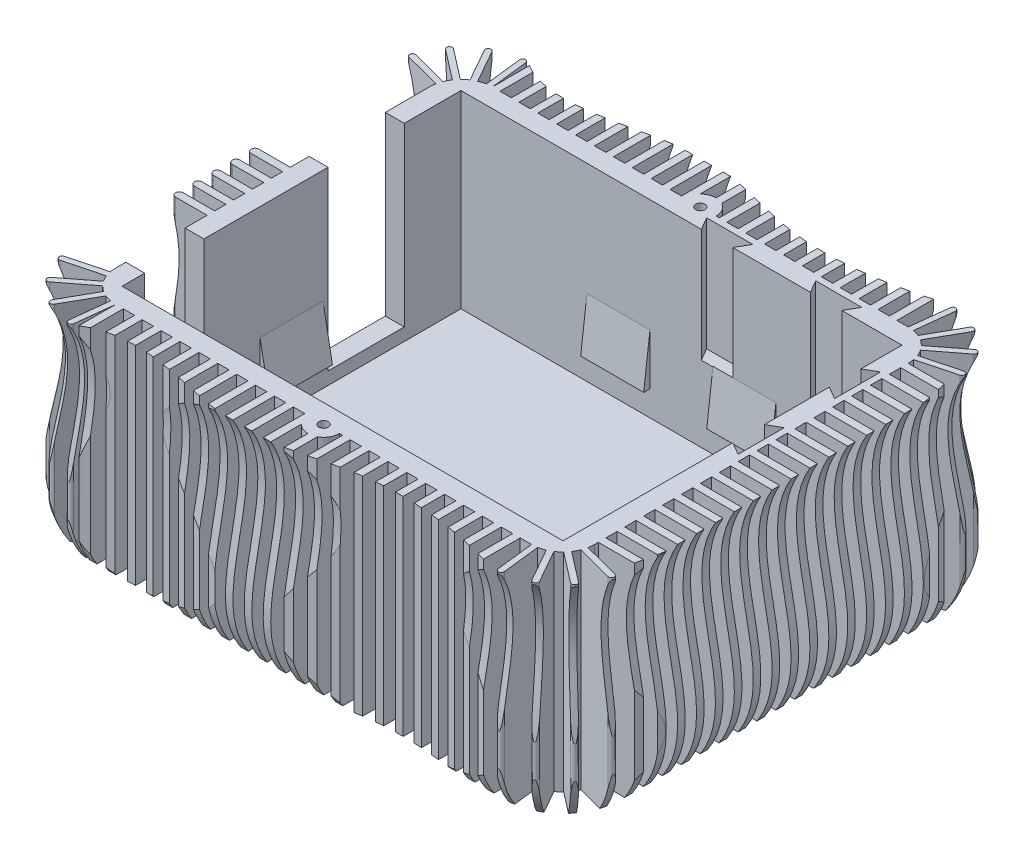
from build123d import *

# Parameters (mm, degrees)
CROQUIS1_W               = 76
CROQUIS1_H               = 59.8
CROQUIS1_W_2             = 70
CROQUIS1_H_2             = 53.8
SALIENTE_EXTRUIR1_DEPTH  = 15
CROQUIS3_W               = 76
CROQUIS3_H               = 59.8
SALIENTE_EXTRUIR2_DEPTH  = 3
CROQUIS4_W               = 6
CROQUIS4_H               = 12.1
CROQUIS4_H_2             = 9.4
CORTAR_EXTRUIR1_DEPTH    = 28
SALIENTE_EXTRUIR3_DEPTH  = 5
SALIENTE_EXTRUIR4_DEPTH  = 5
MATRIZL1_COUNT           = 2
MATRIZL1_PITCH           = 20
MATRIZL2_COUNT           = 2
MATRIZL2_PITCH           = 20
MATRIZL2_COL_COUNT       = 2
MATRIZL2_COL_PITCH       = 20
REDONDEO1_R              = 5
SALIENTE_EXTRUIR6_START  = -18
SALIENTE_EXTRUIR6_DEPTH  = 33
MATRIZL3_COUNT           = 22
MATRIZL3_PITCH           = 3
SIMETR_A1_START          = -18
SIMETR_A1_COPY_1_DEPTH   = 33
SIMETR_A1_COPY_2_DEPTH   = 33
SIMETR_A1_COPY_3_DEPTH   = 33
SIMETR_A1_COPY_4_DEPTH   = 33
SIMETR_A1_COPY_5_DEPTH   = 33
SIMETR_A1_COPY_6_DEPTH   = 33
SIMETR_A1_COPY_7_DEPTH   = 33
SIMETR_A1_COPY_8_DEPTH   = 33
SIMETR_A1_COPY_9_DEPTH   = 33
SIMETR_A1_COPY_10_DEPTH  = 33
SIMETR_A1_COPY_11_DEPTH  = 33
SIMETR_A1_COPY_12_DEPTH  = 33
SIMETR_A1_COPY_13_DEPTH  = 33
SIMETR_A1_COPY_14_DEPTH  = 33
SIMETR_A1_COPY_15_DEPTH  = 33
SIMETR_A1_COPY_16_DEPTH  = 33
SIMETR_A1_COPY_17_DEPTH  = 33
SIMETR_A1_COPY_18_DEPTH  = 33
SIMETR_A1_COPY_19_DEPTH  = 33
SIMETR_A1_COPY_20_DEPTH  = 33
SIMETR_A1_COPY_21_DEPTH  = 33
SALIENTE_EXTRUIR7_DEPTH  = 33
MATRIZ_CRV3_COUNT        = 4
MATRIZ_CRV3_ANGLE        = 68.754935416
SIMETR_A2_COPY_1_DEPTH   = 33
SIMETR_A2_COPY_2_DEPTH   = 33
SIMETR_A2_COPY_3_DEPTH   = 33
SALIENTE_EXTRUIR9_START  = -18
SALIENTE_EXTRUIR9_DEPTH  = 33
MATRIZL4_COUNT           = 17
MATRIZL4_PITCH           = 3
SIMETR_A3_COPY_1_DEPTH   = 33
SIMETR_A3_COPY_2_DEPTH   = 33
SIMETR_A3_COPY_3_DEPTH   = 33
SIMETR_A3_COPY_4_DEPTH   = 33
SIMETR_A3_COPY_5_DEPTH   = 33
SIMETR_A3_COPY_6_DEPTH   = 33
SIMETR_A3_COPY_7_DEPTH   = 33
SALIENTE_EXTRUIR10_START = -18
SALIENTE_EXTRUIR10_DEPTH = 33
SALIENTE_EXTRUIR11_DEPTH = 5
CORTAR_EXTRUIR2_DEPTH    = 18
CORTAR_EXTRUIR3_DEPTH    = 26.5
CORTAR_EXTRUIR4_DEPTH    = 26.5
SALIENTE_EXTRUIR12_START = -18
SALIENTE_EXTRUIR12_DEPTH = 33
CROQUIS19_R              = 0.75
CORTAR_EXTRUIR5_DEPTH    = 53


# Read off the part's stored shape, not the designer's step: Saliente-Extruir12
with BuildPart() as part:
    # Croquis1 → Saliente-Extruir1 (new, symmetric)
    with BuildSketch(Plane(origin=(0, 0, 0), x_dir=(1, 0, 0), z_dir=(0, 1, 0))):
        Rectangle(CROQUIS1_W, CROQUIS1_H)
        Rectangle(CROQUIS1_W_2, CROQUIS1_H_2, mode=Mode.SUBTRACT)
    extrude(amount=SALIENTE_EXTRUIR1_DEPTH, both=True)

    # Croquis3 → Saliente-Extruir2 (add)
    with BuildSketch(Plane.XZ.offset(15)):
        Rectangle(CROQUIS3_W, CROQUIS3_H)
    extrude(amount=SALIENTE_EXTRUIR2_DEPTH)

    # Croquis4 → Cortar-Extruir1 (cut)
    with BuildSketch(Plane(origin=(0, 15, 0), x_dir=(1, 0, 0), z_dir=(0, 1, 0))):
        with Locations((-38, 11.85)):
            Rectangle(CROQUIS4_W, CROQUIS4_H)
        with Locations((-38, -18.6)):
            Rectangle(CROQUIS4_W, CROQUIS4_H_2)
    extrude(amount=-CORTAR_EXTRUIR1_DEPTH, mode=Mode.SUBTRACT)

    # Croquis5 → Saliente-Extruir3 (add, symmetric)
    with BuildSketch(Plane(origin=(0, 0, 0), x_dir=(0, 0, -1), z_dir=(1, 0, 0))):
        Polygon((-26.9, -2.397546426), (-25.905143796, -10.5), (-26.9, -10.5), align=None)
    saliente_extruir3 = extrude(amount=SALIENTE_EXTRUIR3_DEPTH, both=True)

    # Croquis6 → Saliente-Extruir4 (add, symmetric)
    with BuildSketch(Plane(origin=(10, 0, -10), x_dir=(0, 0, 1), z_dir=(-1, 0, 0))):
        Polygon((-16.9, -2.897546426), (-15.905143796, -11), (-16.9, -11), align=None)
    saliente_extruir4 = extrude(amount=SALIENTE_EXTRUIR4_DEPTH, both=True)

    # MatrizL1: Saliente-Extruir4 ×2
    with Locations(*[(-i * MATRIZL1_PITCH, 0, 0) for i in range(1, MATRIZL1_COUNT)]):
        add(saliente_extruir4)

    # MatrizL2: Saliente-Extruir3 ×2
    with Locations(*[(i * MATRIZL2_PITCH, 0, 0) for i in range(1, MATRIZL2_COUNT)]):
        add(saliente_extruir3)

    # MatrizL2 col: Saliente-Extruir3 ×2
    with Locations(*[(-i * MATRIZL2_COL_PITCH, 0, 0) for i in range(1, MATRIZL2_COL_COUNT)]):
        add(saliente_extruir3)

    # Redondeo1
    redondeo1_edges = [part.edges().sort_by_distance(p)[0] for p in [
        (-38, -1.5, 29.9),
        (-38, -1.5, -29.9),
        (38, -1.5, -29.9),
        (38, -1.5, 29.9),
    ]]
    fillet(redondeo1_edges, radius=REDONDEO1_R)

    # Croquis7 → Saliente-Extruir6 (add)
    with BuildSketch(Plane(origin=(0, 0, 0), x_dir=(1, 0, 0), z_dir=(0, 1, 0)).offset(SALIENTE_EXTRUIR6_START)):
        with BuildLine():
            Line((-33, 29.9), (-31.8, 29.9))
            Line((-31.8, 29.9), (-31.8, 37.9))
            ThreePointArc((-31.8, 37.9), (-32.4, 38.5), (-33, 37.9))
            Line((-33, 37.9), (-33, 29.9))
        make_face()
    saliente_extruir6 = extrude(amount=SALIENTE_EXTRUIR6_DEPTH)

    # MatrizL3: Saliente-Extruir6 ×22
    with Locations(*[(i * MATRIZL3_PITCH, 0, 0) for i in range(1, MATRIZL3_COUNT)]):
        add(saliente_extruir6)

    # Simetría1: Saliente-Extruir6 across plane
    add(saliente_extruir6.mirror(Plane.XY))

    # Simetría1 copy 1 sketch → Simetría1 copy 1 (add)
    with BuildSketch(Plane(origin=(3, 0, 0), x_dir=(1, 0, 0), z_dir=(0, 1, 0)).offset(SIMETR_A1_START)):
        with BuildLine():
            Line((-33, -29.9), (-31.8, -29.9))
            Line((-31.8, -29.9), (-31.8, -37.9))
            ThreePointArc((-31.8, -37.9), (-32.4, -38.5), (-33, -37.9))
            Line((-33, -37.9), (-33, -29.9))
        make_face()
    extrude(amount=SIMETR_A1_COPY_1_DEPTH)

    # Simetría1 copy 2 sketch → Simetría1 copy 2 (add)
    with BuildSketch(Plane(origin=(6, 0, 0), x_dir=(1, 0, 0), z_dir=(0, 1, 0)).offset(SIMETR_A1_START)):
        with BuildLine():
            Line((-33, -29.9), (-31.8, -29.9))
            Line((-31.8, -29.9), (-31.8, -37.9))
            ThreePointArc((-31.8, -37.9), (-32.4, -38.5), (-33, -37.9))
            Line((-33, -37.9), (-33, -29.9))
        make_face()
    extrude(amount=SIMETR_A1_COPY_2_DEPTH)

    # Simetría1 copy 3 sketch → Simetría1 copy 3 (add)
    with BuildSketch(Plane(origin=(9, 0, 0), x_dir=(1, 0, 0), z_dir=(0, 1, 0)).offset(SIMETR_A1_START)):
        with BuildLine():
            Line((-33, -29.9), (-31.8, -29.9))
            Line((-31.8, -29.9), (-31.8, -37.9))
            ThreePointArc((-31.8, -37.9), (-32.4, -38.5), (-33, -37.9))
            Line((-33, -37.9), (-33, -29.9))
        make_face()
    extrude(amount=SIMETR_A1_COPY_3_DEPTH)

    # Simetría1 copy 4 sketch → Simetría1 copy 4 (add)
    with BuildSketch(Plane(origin=(12, 0, 0), x_dir=(1, 0, 0), z_dir=(0, 1, 0)).offset(SIMETR_A1_START)):
        with BuildLine():
            Line((-33, -29.9), (-31.8, -29.9))
            Line((-31.8, -29.9), (-31.8, -37.9))
            ThreePointArc((-31.8, -37.9), (-32.4, -38.5), (-33, -37.9))
            Line((-33, -37.9), (-33, -29.9))
        make_face()
    extrude(amount=SIMETR_A1_COPY_4_DEPTH)

    # Simetría1 copy 5 sketch → Simetría1 copy 5 (add)
    with BuildSketch(Plane(origin=(15, 0, 0), x_dir=(1, 0, 0), z_dir=(0, 1, 0)).offset(SIMETR_A1_START)):
        with BuildLine():
            Line((-33, -29.9), (-31.8, -29.9))
            Line((-31.8, -29.9), (-31.8, -37.9))
            ThreePointArc((-31.8, -37.9), (-32.4, -38.5), (-33, -37.9))
            Line((-33, -37.9), (-33, -29.9))
        make_face()
    extrude(amount=SIMETR_A1_COPY_5_DEPTH)

    # Simetría1 copy 6 sketch → Simetría1 copy 6 (add)
    with BuildSketch(Plane(origin=(18, 0, 0), x_dir=(1, 0, 0), z_dir=(0, 1, 0)).offset(SIMETR_A1_START)):
        with BuildLine():
            Line((-33, -29.9), (-31.8, -29.9))
            Line((-31.8, -29.9), (-31.8, -37.9))
            ThreePointArc((-31.8, -37.9), (-32.4, -38.5), (-33, -37.9))
            Line((-33, -37.9), (-33, -29.9))
        make_face()
    extrude(amount=SIMETR_A1_COPY_6_DEPTH)

    # Simetría1 copy 7 sketch → Simetría1 copy 7 (add)
    with BuildSketch(Plane(origin=(21, 0, 0), x_dir=(1, 0, 0), z_dir=(0, 1, 0)).offset(SIMETR_A1_START)):
        with BuildLine():
            Line((-33, -29.9), (-31.8, -29.9))
            Line((-31.8, -29.9), (-31.8, -37.9))
            ThreePointArc((-31.8, -37.9), (-32.4, -38.5), (-33, -37.9))
            Line((-33, -37.9), (-33, -29.9))
        make_face()
    extrude(amount=SIMETR_A1_COPY_7_DEPTH)

    # Simetría1 copy 8 sketch → Simetría1 copy 8 (add)
    with BuildSketch(Plane(origin=(24, 0, 0), x_dir=(1, 0, 0), z_dir=(0, 1, 0)).offset(SIMETR_A1_START)):
        with BuildLine():
            Line((-33, -29.9), (-31.8, -29.9))
            Line((-31.8, -29.9), (-31.8, -37.9))
            ThreePointArc((-31.8, -37.9), (-32.4, -38.5), (-33, -37.9))
            Line((-33, -37.9), (-33, -29.9))
        make_face()
    extrude(amount=SIMETR_A1_COPY_8_DEPTH)

    # Simetría1 copy 9 sketch → Simetría1 copy 9 (add)
    with BuildSketch(Plane(origin=(27, 0, 0), x_dir=(1, 0, 0), z_dir=(0, 1, 0)).offset(SIMETR_A1_START)):
        with BuildLine():
            Line((-33, -29.9), (-31.8, -29.9))
            Line((-31.8, -29.9), (-31.8, -37.9))
            ThreePointArc((-31.8, -37.9), (-32.4, -38.5), (-33, -37.9))
            Line((-33, -37.9), (-33, -29.9))
        make_face()
    extrude(amount=SIMETR_A1_COPY_9_DEPTH)

    # Simetría1 copy 10 sketch → Simetría1 copy 10 (add)
    with BuildSketch(Plane(origin=(30, 0, 0), x_dir=(1, 0, 0), z_dir=(0, 1, 0)).offset(SIMETR_A1_START)):
        with BuildLine():
            Line((-33, -29.9), (-31.8, -29.9))
            Line((-31.8, -29.9), (-31.8, -37.9))
            ThreePointArc((-31.8, -37.9), (-32.4, -38.5), (-33, -37.9))
            Line((-33, -37.9), (-33, -29.9))
        make_face()
    extrude(amount=SIMETR_A1_COPY_10_DEPTH)

    # Simetría1 copy 11 sketch → Simetría1 copy 11 (add)
    with BuildSketch(Plane(origin=(33, 0, 0), x_dir=(1, 0, 0), z_dir=(0, 1, 0)).offset(SIMETR_A1_START)):
        with BuildLine():
            Line((-33, -29.9), (-31.8, -29.9))
            Line((-31.8, -29.9), (-31.8, -37.9))
            ThreePointArc((-31.8, -37.9), (-32.4, -38.5), (-33, -37.9))
            Line((-33, -37.9), (-33, -29.9))
        make_face()
    extrude(amount=SIMETR_A1_COPY_11_DEPTH)

    # Simetría1 copy 12 sketch → Simetría1 copy 12 (add)
    with BuildSketch(Plane(origin=(36, 0, 0), x_dir=(1, 0, 0), z_dir=(0, 1, 0)).offset(SIMETR_A1_START)):
        with BuildLine():
            Line((-33, -29.9), (-31.8, -29.9))
            Line((-31.8, -29.9), (-31.8, -37.9))
            ThreePointArc((-31.8, -37.9), (-32.4, -38.5), (-33, -37.9))
            Line((-33, -37.9), (-33, -29.9))
        make_face()
    extrude(amount=SIMETR_A1_COPY_12_DEPTH)

    # Simetría1 copy 13 sketch → Simetría1 copy 13 (add)
    with BuildSketch(Plane(origin=(39, 0, 0), x_dir=(1, 0, 0), z_dir=(0, 1, 0)).offset(SIMETR_A1_START)):
        with BuildLine():
            Line((-33, -29.9), (-31.8, -29.9))
            Line((-31.8, -29.9), (-31.8, -37.9))
            ThreePointArc((-31.8, -37.9), (-32.4, -38.5), (-33, -37.9))
            Line((-33, -37.9), (-33, -29.9))
        make_face()
    extrude(amount=SIMETR_A1_COPY_13_DEPTH)

    # Simetría1 copy 14 sketch → Simetría1 copy 14 (add)
    with BuildSketch(Plane(origin=(42, 0, 0), x_dir=(1, 0, 0), z_dir=(0, 1, 0)).offset(SIMETR_A1_START)):
        with BuildLine():
            Line((-33, -29.9), (-31.8, -29.9))
            Line((-31.8, -29.9), (-31.8, -37.9))
            ThreePointArc((-31.8, -37.9), (-32.4, -38.5), (-33, -37.9))
            Line((-33, -37.9), (-33, -29.9))
        make_face()
    extrude(amount=SIMETR_A1_COPY_14_DEPTH)

    # Simetría1 copy 15 sketch → Simetría1 copy 15 (add)
    with BuildSketch(Plane(origin=(45, 0, 0), x_dir=(1, 0, 0), z_dir=(0, 1, 0)).offset(SIMETR_A1_START)):
        with BuildLine():
            Line((-33, -29.9), (-31.8, -29.9))
            Line((-31.8, -29.9), (-31.8, -37.9))
            ThreePointArc((-31.8, -37.9), (-32.4, -38.5), (-33, -37.9))
            Line((-33, -37.9), (-33, -29.9))
        make_face()
    extrude(amount=SIMETR_A1_COPY_15_DEPTH)

    # Simetría1 copy 16 sketch → Simetría1 copy 16 (add)
    with BuildSketch(Plane(origin=(48, 0, 0), x_dir=(1, 0, 0), z_dir=(0, 1, 0)).offset(SIMETR_A1_START)):
        with BuildLine():
            Line((-33, -29.9), (-31.8, -29.9))
            Line((-31.8, -29.9), (-31.8, -37.9))
            ThreePointArc((-31.8, -37.9), (-32.4, -38.5), (-33, -37.9))
            Line((-33, -37.9), (-33, -29.9))
        make_face()
    extrude(amount=SIMETR_A1_COPY_16_DEPTH)

    # Simetría1 copy 17 sketch → Simetría1 copy 17 (add)
    with BuildSketch(Plane(origin=(51, 0, 0), x_dir=(1, 0, 0), z_dir=(0, 1, 0)).offset(SIMETR_A1_START)):
        with BuildLine():
            Line((-33, -29.9), (-31.8, -29.9))
            Line((-31.8, -29.9), (-31.8, -37.9))
            ThreePointArc((-31.8, -37.9), (-32.4, -38.5), (-33, -37.9))
            Line((-33, -37.9), (-33, -29.9))
        make_face()
    extrude(amount=SIMETR_A1_COPY_17_DEPTH)

    # Simetría1 copy 18 sketch → Simetría1 copy 18 (add)
    with BuildSketch(Plane(origin=(54, 0, 0), x_dir=(1, 0, 0), z_dir=(0, 1, 0)).offset(SIMETR_A1_START)):
        with BuildLine():
            Line((-33, -29.9), (-31.8, -29.9))
            Line((-31.8, -29.9), (-31.8, -37.9))
            ThreePointArc((-31.8, -37.9), (-32.4, -38.5), (-33, -37.9))
            Line((-33, -37.9), (-33, -29.9))
        make_face()
    extrude(amount=SIMETR_A1_COPY_18_DEPTH)

    # Simetría1 copy 19 sketch → Simetría1 copy 19 (add)
    with BuildSketch(Plane(origin=(57, 0, 0), x_dir=(1, 0, 0), z_dir=(0, 1, 0)).offset(SIMETR_A1_START)):
        with BuildLine():
            Line((-33, -29.9), (-31.8, -29.9))
            Line((-31.8, -29.9), (-31.8, -37.9))
            ThreePointArc((-31.8, -37.9), (-32.4, -38.5), (-33, -37.9))
            Line((-33, -37.9), (-33, -29.9))
        make_face()
    extrude(amount=SIMETR_A1_COPY_19_DEPTH)

    # Simetría1 copy 20 sketch → Simetría1 copy 20 (add)
    with BuildSketch(Plane(origin=(60, 0, 0), x_dir=(1, 0, 0), z_dir=(0, 1, 0)).offset(SIMETR_A1_START)):
        with BuildLine():
            Line((-33, -29.9), (-31.8, -29.9))
            Line((-31.8, -29.9), (-31.8, -37.9))
            ThreePointArc((-31.8, -37.9), (-32.4, -38.5), (-33, -37.9))
            Line((-33, -37.9), (-33, -29.9))
        make_face()
    extrude(amount=SIMETR_A1_COPY_20_DEPTH)

    # Simetría1 copy 21 sketch → Simetría1 copy 21 (add)
    with BuildSketch(Plane(origin=(63, 0, 0), x_dir=(1, 0, 0), z_dir=(0, 1, 0)).offset(SIMETR_A1_START)):
        with BuildLine():
            Line((-33, -29.9), (-31.8, -29.9))
            Line((-31.8, -29.9), (-31.8, -37.9))
            ThreePointArc((-31.8, -37.9), (-32.4, -38.5), (-33, -37.9))
            Line((-33, -37.9), (-33, -29.9))
        make_face()
    extrude(amount=SIMETR_A1_COPY_21_DEPTH)

    # Croquis9 → Saliente-Extruir7 (add, through all)
    with BuildSketch(Plane(origin=(0, 15, 0), x_dir=(1, 0, 0), z_dir=(0, 1, 0))):
        with BuildLine():
            Line((33.685639557, 35.882409122), (33, 29.9))
            ThreePointArc((33, 29.9), (33.450129237, 29.879697146), (33.896602911, 29.818953468))
            Line((33.896602911, 29.818953468), (34.57978628, 35.779931616))
            Line((34.57978628, 35.779931616), (33.685639557, 35.882409122))
        make_face()
        with BuildLine():
            ThreePointArc((33.685639557, 35.882409122), (34.183951671, 36.27824373), (34.57978628, 35.779931616))
            Line((34.57978628, 35.779931616), (33.685639557, 35.882409122))
        make_face()
    saliente_extruir7 = extrude(amount=-SALIENTE_EXTRUIR7_DEPTH)

    # Matriz Crv3: Saliente-Extruir7 ×4 about axis
    matriz_crv3_axis = Axis((33, 15, -24.9), (0, -1, 0))
    for i in range(1, MATRIZ_CRV3_COUNT):
        add(saliente_extruir7.rotate(matriz_crv3_axis, i * MATRIZ_CRV3_ANGLE / (MATRIZ_CRV3_COUNT - 1)))

    # Simetría2: Saliente-Extruir7 across plane
    add(saliente_extruir7.mirror(Plane.XY))

    # Simetría2 copy 1 sketch → Simetría2 copy 1 (add, through all)
    with BuildSketch(Plane(origin=(-7.091529526, 15, 14.816386546), x_dir=(0.9210609940028849, 0, -0.3894183423086511), z_dir=(0, 1, 0))):
        with BuildLine():
            Line((33.685639557, -35.882409122), (33, -29.9))
            ThreePointArc((33, -29.9), (33.450129237, -29.879697146), (33.896602911, -29.818953468))
            Line((33.896602911, -29.818953468), (34.57978628, -35.779931616))
            Line((34.57978628, -35.779931616), (33.685639557, -35.882409122))
        make_face()
        with BuildLine():
            ThreePointArc((33.685639557, -35.882409122), (34.183951671, -36.27824373), (34.57978628, -35.779931616))
            Line((34.57978628, -35.779931616), (33.685639557, -35.882409122))
        make_face()
    extrude(amount=-SIMETR_A2_COPY_1_DEPTH)

    # Simetría2 copy 2 sketch → Simetría2 copy 2 (add, through all)
    with BuildSketch(Plane(origin=(-7.853488072, 15, 31.224753937), x_dir=(0.6967067093471645, 0, -0.7173560908995237), z_dir=(0, 1, 0))):
        with BuildLine():
            Line((33.685639557, -35.882409122), (33, -29.9))
            ThreePointArc((33, -29.9), (33.450129237, -29.879697146), (33.896602911, -29.818953468))
            Line((33.896602911, -29.818953468), (34.57978628, -35.779931616))
            Line((34.57978628, -35.779931616), (33.685639557, -35.882409122))
        make_face()
        with BuildLine():
            ThreePointArc((33.685639557, -35.882409122), (34.183951671, -36.27824373), (34.57978628, -35.779931616))
            Line((34.57978628, -35.779931616), (33.685639557, -35.882409122))
        make_face()
    extrude(amount=-SIMETR_A2_COPY_2_DEPTH)

    # Simetría2 copy 3 sketch → Simetría2 copy 3 (add, through all)
    with BuildSketch(Plane(origin=(-2.165579138, 15, 46.63458175), x_dir=(0.36235775447667173, 0, -0.9320390859672271), z_dir=(0, 1, 0))):
        with BuildLine():
            Line((33.685639557, -35.882409122), (33, -29.9))
            ThreePointArc((33, -29.9), (33.450129237, -29.879697146), (33.896602911, -29.818953468))
            Line((33.896602911, -29.818953468), (34.57978628, -35.779931616))
            Line((34.57978628, -35.779931616), (33.685639557, -35.882409122))
        make_face()
        with BuildLine():
            ThreePointArc((33.685639557, -35.882409122), (34.183951671, -36.27824373), (34.57978628, -35.779931616))
            Line((34.57978628, -35.779931616), (33.685639557, -35.882409122))
        make_face()
    extrude(amount=-SIMETR_A2_COPY_3_DEPTH)

    # Croquis11 → Saliente-Extruir9 (add)
    with BuildSketch(Plane(origin=(0, 0, 0), x_dir=(1, 0, 0), z_dir=(0, 1, 0)).offset(SALIENTE_EXTRUIR9_START)):
        with BuildLine():
            Line((38, 24.9), (46, 24.9))
            ThreePointArc((46, 24.9), (46.6, 24.3), (46, 23.7))
            Line((46, 23.7), (38, 23.7))
            Line((38, 23.7), (38, 24.9))
        make_face()
    saliente_extruir9 = extrude(amount=SALIENTE_EXTRUIR9_DEPTH)

    # MatrizL4: Saliente-Extruir9 ×17
    with Locations(*[(0, 0, i * MATRIZL4_PITCH) for i in range(1, MATRIZL4_COUNT)]):
        add(saliente_extruir9)

    # Simetría3: Saliente-Extruir7 across plane
    add(saliente_extruir7.mirror(Plane(origin=(0, 0, 0), x_dir=(0, 0, 1), z_dir=(1, 0, 0))))

    # Simetría3 copy 1 sketch → Simetría3 copy 1 (add, through all)
    with BuildSketch(Plane(origin=(7.091529526, 15, -14.816386546), x_dir=(-0.9210609940028849, 0, 0.3894183423086511), z_dir=(0, 1, 0))):
        with BuildLine():
            Line((33.685639557, -35.882409122), (33, -29.9))
            ThreePointArc((33, -29.9), (33.450129237, -29.879697146), (33.896602911, -29.818953468))
            Line((33.896602911, -29.818953468), (34.57978628, -35.779931616))
            Line((34.57978628, -35.779931616), (33.685639557, -35.882409122))
        make_face()
        with BuildLine():
            ThreePointArc((33.685639557, -35.882409122), (34.183951671, -36.27824373), (34.57978628, -35.779931616))
            Line((34.57978628, -35.779931616), (33.685639557, -35.882409122))
        make_face()
    extrude(amount=-SIMETR_A3_COPY_1_DEPTH)

    # Simetría3 copy 2 sketch → Simetría3 copy 2 (add, through all)
    with BuildSketch(Plane(origin=(7.853488072, 15, -31.224753937), x_dir=(-0.6967067093471645, 0, 0.7173560908995237), z_dir=(0, 1, 0))):
        with BuildLine():
            Line((33.685639557, -35.882409122), (33, -29.9))
            ThreePointArc((33, -29.9), (33.450129237, -29.879697146), (33.896602911, -29.818953468))
            Line((33.896602911, -29.818953468), (34.57978628, -35.779931616))
            Line((34.57978628, -35.779931616), (33.685639557, -35.882409122))
        make_face()
        with BuildLine():
            ThreePointArc((33.685639557, -35.882409122), (34.183951671, -36.27824373), (34.57978628, -35.779931616))
            Line((34.57978628, -35.779931616), (33.685639557, -35.882409122))
        make_face()
    extrude(amount=-SIMETR_A3_COPY_2_DEPTH)

    # Simetría3 copy 3 sketch → Simetría3 copy 3 (add, through all)
    with BuildSketch(Plane(origin=(2.165579138, 15, -46.63458175), x_dir=(-0.36235775447667173, 0, 0.9320390859672271), z_dir=(0, 1, 0))):
        with BuildLine():
            Line((33.685639557, -35.882409122), (33, -29.9))
            ThreePointArc((33, -29.9), (33.450129237, -29.879697146), (33.896602911, -29.818953468))
            Line((33.896602911, -29.818953468), (34.57978628, -35.779931616))
            Line((34.57978628, -35.779931616), (33.685639557, -35.882409122))
        make_face()
        with BuildLine():
            ThreePointArc((33.685639557, -35.882409122), (34.183951671, -36.27824373), (34.57978628, -35.779931616))
            Line((34.57978628, -35.779931616), (33.685639557, -35.882409122))
        make_face()
    extrude(amount=-SIMETR_A3_COPY_3_DEPTH)

    # Simetría3 copy 4 sketch → Simetría3 copy 4 (add, through all)
    with BuildSketch(Plane(origin=(0, 15, 0), x_dir=(-1, 0, 0), z_dir=(0, 1, 0))):
        with BuildLine():
            Line((33.685639557, 35.882409122), (33, 29.9))
            ThreePointArc((33, 29.9), (33.450129237, 29.879697146), (33.896602911, 29.818953468))
            Line((33.896602911, 29.818953468), (34.57978628, 35.779931616))
            Line((34.57978628, 35.779931616), (33.685639557, 35.882409122))
        make_face()
        with BuildLine():
            ThreePointArc((33.685639557, 35.882409122), (34.183951671, 36.27824373), (34.57978628, 35.779931616))
            Line((34.57978628, 35.779931616), (33.685639557, 35.882409122))
        make_face()
    extrude(amount=-SIMETR_A3_COPY_4_DEPTH)

    # Simetría3 copy 5 sketch → Simetría3 copy 5 (add, through all)
    with BuildSketch(Plane(origin=(7.091529526, 15, 14.816386546), x_dir=(-0.9210609940028849, 0, -0.3894183423086511), z_dir=(0, 1, 0))):
        with BuildLine():
            Line((33.685639557, 35.882409122), (33, 29.9))
            ThreePointArc((33, 29.9), (33.450129237, 29.879697146), (33.896602911, 29.818953468))
            Line((33.896602911, 29.818953468), (34.57978628, 35.779931616))
            Line((34.57978628, 35.779931616), (33.685639557, 35.882409122))
        make_face()
        with BuildLine():
            ThreePointArc((33.685639557, 35.882409122), (34.183951671, 36.27824373), (34.57978628, 35.779931616))
            Line((34.57978628, 35.779931616), (33.685639557, 35.882409122))
        make_face()
    extrude(amount=-SIMETR_A3_COPY_5_DEPTH)

    # Simetría3 copy 6 sketch → Simetría3 copy 6 (add, through all)
    with BuildSketch(Plane(origin=(7.853488072, 15, 31.224753937), x_dir=(-0.6967067093471645, 0, -0.7173560908995237), z_dir=(0, 1, 0))):
        with BuildLine():
            Line((33.685639557, 35.882409122), (33, 29.9))
            ThreePointArc((33, 29.9), (33.450129237, 29.879697146), (33.896602911, 29.818953468))
            Line((33.896602911, 29.818953468), (34.57978628, 35.779931616))
            Line((34.57978628, 35.779931616), (33.685639557, 35.882409122))
        make_face()
        with BuildLine():
            ThreePointArc((33.685639557, 35.882409122), (34.183951671, 36.27824373), (34.57978628, 35.779931616))
            Line((34.57978628, 35.779931616), (33.685639557, 35.882409122))
        make_face()
    extrude(amount=-SIMETR_A3_COPY_6_DEPTH)

    # Simetría3 copy 7 sketch → Simetría3 copy 7 (add, through all)
    with BuildSketch(Plane(origin=(2.165579138, 15, 46.63458175), x_dir=(-0.36235775447667173, 0, -0.9320390859672271), z_dir=(0, 1, 0))):
        with BuildLine():
            Line((33.685639557, 35.882409122), (33, 29.9))
            ThreePointArc((33, 29.9), (33.450129237, 29.879697146), (33.896602911, 29.818953468))
            Line((33.896602911, 29.818953468), (34.57978628, 35.779931616))
            Line((34.57978628, 35.779931616), (33.685639557, 35.882409122))
        make_face()
        with BuildLine():
            ThreePointArc((33.685639557, 35.882409122), (34.183951671, 36.27824373), (34.57978628, 35.779931616))
            Line((34.57978628, 35.779931616), (33.685639557, 35.882409122))
        make_face()
    extrude(amount=-SIMETR_A3_COPY_7_DEPTH)

    # Croquis12 → Saliente-Extruir10 (add)
    with BuildSketch(Plane(origin=(0, 0, 0), x_dir=(1, 0, 0), z_dir=(0, 1, 0)).offset(SALIENTE_EXTRUIR10_START)):
        with BuildLine():
            Line((-38, 2.8), (-43, 2.8))
            ThreePointArc((-43, 2.8), (-43.6, 2.2), (-43, 1.6))
            Line((-43, 1.6), (-38, 1.6))
            Line((-38, 1.6), (-38, 2.8))
        make_face()
        with BuildLine():
            Line((-38, -0.2), (-43, -0.2))
            ThreePointArc((-43, -0.2), (-43.6, -0.8), (-43, -1.4))
            Line((-43, -1.4), (-38, -1.4))
            Line((-38, -1.4), (-38, -0.2))
        make_face()
        with BuildLine():
            Line((-38, -3.2), (-43, -3.2))
            ThreePointArc((-43, -3.2), (-43.6, -3.8), (-43, -4.4))
            Line((-43, -4.4), (-38, -4.4))
            Line((-38, -4.4), (-38, -3.2))
        make_face()
        with BuildLine():
            Line((-38, -6.2), (-43, -6.2))
            ThreePointArc((-43, -6.2), (-43.6, -6.8), (-43, -7.4))
            Line((-43, -7.4), (-38, -7.4))
            Line((-38, -7.4), (-38, -6.2))
        make_face()
        with BuildLine():
            Line((-38, -9.2), (-43, -9.2))
            ThreePointArc((-43, -9.2), (-43.6, -9.8), (-43, -10.4))
            Line((-43, -10.4), (-38, -10.4))
            Line((-38, -10.4), (-38, -9.2))
        make_face()
    extrude(amount=SALIENTE_EXTRUIR10_DEPTH)

    # Croquis14 → Saliente-Extruir11 (add, symmetric)
    with BuildSketch(Plane.XY):
        Polygon((-35, -11), (-33.5, -11), (-35, -3), align=None)
    extrude(amount=SALIENTE_EXTRUIR11_DEPTH, both=True)

    # Croquis15 → Cortar-Extruir2 (cut)
    with BuildSketch(Plane(origin=(0, 15, 0), x_dir=(1, 0, 0), z_dir=(0, 1, 0))):
        Polygon((35, 20.364101615), (37, 21.518802154), (37, 14.209401077), (35, 15.364101615), align=None)
        Polygon((35, 0.054700538), (35, 5.054700538), (37, 6.209401077), (37, -1.1), align=None)
        Polygon((25.464101615, 26.9), (26.618802154, 28.9), (19.309401077, 28.9), (20.464101615, 26.9), align=None)
        Polygon((8.154700538, 26.9), (3.154700538, 26.9), (2, 28.9), (9.309401077, 28.9), align=None)
    extrude(amount=-CORTAR_EXTRUIR2_DEPTH, mode=Mode.SUBTRACT)

    # Croquis16 → Cortar-Extruir3 (cut, symmetric)
    with BuildSketch(Plane(origin=(0, 0, 0), x_dir=(1, 0, 0), z_dir=(0, 1, 0))):
        with BuildLine():
            Line((35.93811427, 37.252375928), (35.93811427, 40.676812165))
            Line((35.93811427, 40.676812165), (-37.456065326, 40.676812165))
            add(Edge.make_bspline(
                [(-37.456065326, 40.676812165), (-33.333681928, 32.866675069), (-20.085054909, 33.912652214), (-4.604144074, 38.425808524), (13.48492343, 31.389797575), (28.552983147, 34.581293937), (35.93811427, 37.252375928)],
                knots=[0, 0, 0, 0, 0.256410502, 0.449081952, 0.65236191, 1, 1, 1, 1], degree=3))
        make_face()
    cortar_extruir3 = extrude(amount=CORTAR_EXTRUIR3_DEPTH, both=True, mode=Mode.SUBTRACT)

    # Simetría4: Cortar-Extruir3 across plane
    add(cortar_extruir3.mirror(Plane.XY), mode=Mode.SUBTRACT)

    # Croquis17 → Cortar-Extruir4 (cut, symmetric)
    with BuildSketch(Plane(origin=(0, 0, 0), x_dir=(1, 0, 0), z_dir=(0, 1, 0))):
        with BuildLine():
            Line((43.712969328, 24.9), (48.712969328, 24.9))
            Line((48.712969328, 24.9), (48.712969328, -24.3))
            Line((48.712969328, -24.3), (43.712969328, -24.3))
            ThreePointArc((43.712969328, -24.3), (46.6, 0.3), (43.712969328, 24.9))
        make_face()
    extrude(amount=CORTAR_EXTRUIR4_DEPTH, both=True, mode=Mode.SUBTRACT)

    # Saliente-Extruir12 outline → Saliente-Extruir12 (add)
    with BuildSketch(Plane(origin=(0, 0, 0), x_dir=(1, 0, 0), z_dir=(0, 1, 0)).offset(SALIENTE_EXTRUIR12_START)):
        with BuildLine():
            Line((0, 29.9), (0, 32.4))
            ThreePointArc((0, 32.4), (-0.977921803, 32.200797459), (-1.8, 31.634935157))
            Line((-1.8, 31.634935157), (-1.8, 29.9))
            Line((-1.8, 29.9), (0, 29.9))
        make_face()
        with BuildLine():
            Line((1.2, 29.9), (2.5, 29.9))
            ThreePointArc((2.5, 29.9), (2.150581317, 31.174754878), (1.2, 32.09317122))
            Line((1.2, 32.09317122), (1.2, 29.9))
        make_face()
        with BuildLine():
            Line((-1.8, -29.9), (-1.8, -31.634935157))
            ThreePointArc((-1.8, -31.634935157), (-0.977921803, -32.200797459), (0, -32.4))
            Line((0, -32.4), (0, -29.9))
            Line((0, -29.9), (-1.8, -29.9))
        make_face()
        with BuildLine():
            Line((1.2, -29.9), (1.2, -32.09317122))
            ThreePointArc((1.2, -32.09317122), (2.150581317, -31.174754878), (2.5, -29.9))
            Line((2.5, -29.9), (1.2, -29.9))
        make_face()
    extrude(amount=SALIENTE_EXTRUIR12_DEPTH)

    # Croquis19 → Cortar-Extruir5 (cut)
    with BuildSketch(Plane(origin=(0, 15, 0), x_dir=(1, 0, 0), z_dir=(0, 1, 0))):
        with Locations(Location((0, 29.9, 0), (0, 0, 270))):
            Circle(CROQUIS19_R)
        with Locations(Location((0, -29.9, 0), (0, 0, 90))):
            Circle(CROQUIS19_R)
    extrude(amount=-CORTAR_EXTRUIR5_DEPTH, mode=Mode.SUBTRACT)

    # Cortar-Barrer1: sweep along a path in Croquis21
    with BuildLine(Plane(origin=(0, 0, 0), x_dir=(1, 0, 0), z_dir=(0, 1, 0))) as cortar_barrer1_path:
        Line((-43, 17.9), (-43, -24.9))
        ThreePointArc((-43, -24.9), (-40.071067812, -31.971067812), (-33, -34.9))
        Line((-33, -34.9), (33, -34.9))
        ThreePointArc((33, -34.9), (40.071067812, -31.971067812), (43, -24.9))
        Line((43, -24.9), (43, 24.9))
        ThreePointArc((43, 24.9), (40.071067812, 31.971067812), (33, 34.9))
        Line((33, 34.9), (-33, 34.9))
        ThreePointArc((-33, 34.9), (-40.071067812, 31.971067812), (-43, 24.9))
        Line((-43, 24.9), (-43, 17.9))
    # Croquis20 → Cortar-Barrer1 (sweep, cut)
    with BuildSketch(Plane(origin=(0, 0, 0), x_dir=(0, 0, -1), z_dir=(1, 0, 0))):
        with BuildLine():
            Line((-36.496124799, 15), (-39.847767164, 15))
            Line((-39.847767164, 15), (-39.847767164, -18))
            Line((-39.847767164, -18), (-34.065529978, -18))
            add(Edge.make_bspline(
                [(-36.496124799, 15), (-29.943706269, 4.026936448), (-41.10557955, -7.532524487), (-34.065529978, -18)],
                knots=[0, 0, 0, 0, 1, 1, 1, 1], degree=3))
        make_face()
    sweep(path=cortar_barrer1_path.line, mode=Mode.SUBTRACT)


solid = part.part
